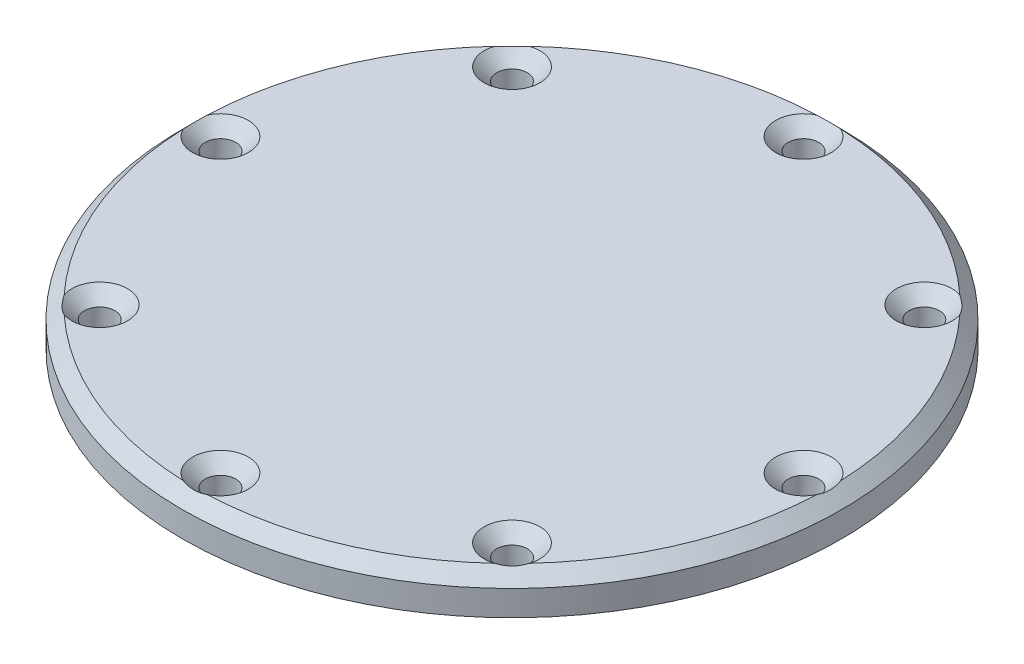
from build123d import *

# Parameters (mm, degrees)
HOLE_WIZARD_M21_D           = 2.4
HOLE_WIZARD_M21_CSINK_D     = 4.4
HOLE_WIZARD_M21_CSINK_ANGLE = 90
PATTERN_CIRCULAR_1_COUNT    = 8


with BuildPart() as part:
    # Эскиз1 → Повернуть1 (revolve)
    with BuildSketch(Plane.XY):
        Polygon((0, 0), (26, 0), (26, 2), (25, 3), (0, 3), align=None)
    revolve(axis=Axis((0, 0, 0), (0, 1, 0)))

    # Зенковка для винта с потайной головкой M21 (through all)
    with Locations(Plane(origin=(0, 3, 0), x_dir=(1, 0, 0), z_dir=(0, 1, 0))):
        with Locations((16.263455967, 16.263455967)):
            hole_wizard_m21 = CounterSinkHole(HOLE_WIZARD_M21_D / 2, HOLE_WIZARD_M21_CSINK_D / 2, counter_sink_angle=HOLE_WIZARD_M21_CSINK_ANGLE)

    # Круговой массив1: Зенковка для винта с потайной головкой M21 ×8 about axis
    pattern_circular_1_axis = Axis((0, 0, 0), (0, -1, 0))
    for i in range(1, PATTERN_CIRCULAR_1_COUNT):
        add(hole_wizard_m21.rotate(pattern_circular_1_axis, i * 360 / PATTERN_CIRCULAR_1_COUNT), mode=Mode.SUBTRACT)


solid = part.part
